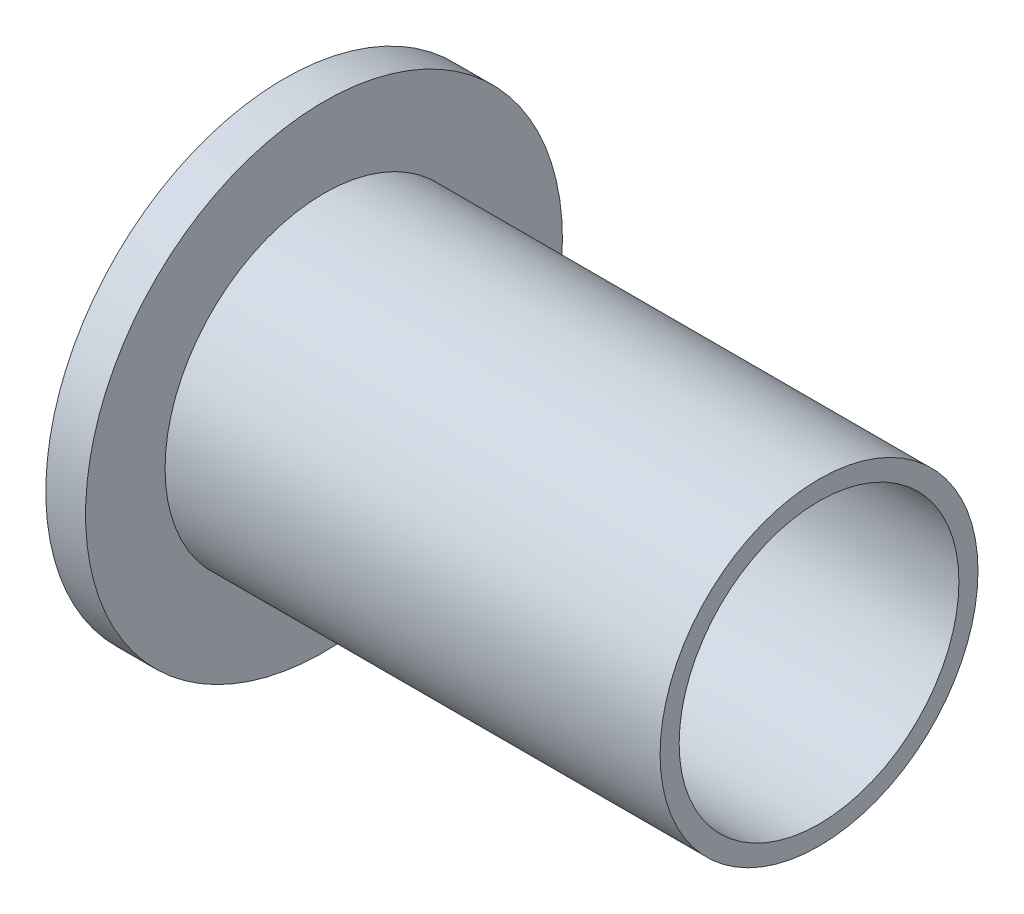
from build123d import *


with BuildPart() as part:
    # Sketch1 → Revolve1 (revolve)
    with BuildSketch(Plane.XY):
        Polygon((0, 9.525), (0, 5.588), (21.36394, 5.588), (21.36394, 6.35), (1.5875, 6.35), (1.5875, 9.525), align=None)
    revolve(axis=Axis((21.36394, 0, 0), (-1, 0, 0)))


solid = part.part
